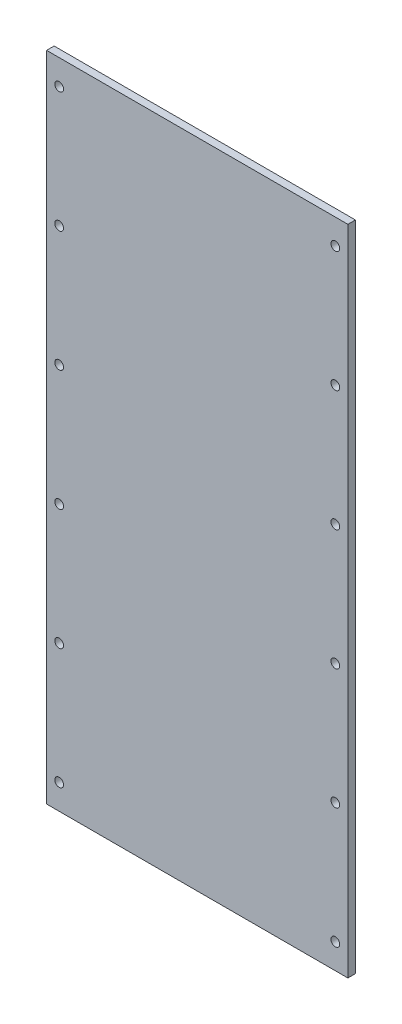
from build123d import *

# Parameters (mm, degrees)
ESQUISSE1_W             = 120
ESQUISSE1_H             = 260
BOSS_EXTRU_1_DEPTH      = 3
ESQUISSE2_R             = 1.747592995
ENL_V_MAT_EXTRU_1_DEPTH = 10


with BuildPart() as part:
    # Esquisse1 → Boss.-Extru.1 (new body)
    with BuildSketch(Plane.XY):
        Rectangle(ESQUISSE1_W, ESQUISSE1_H)
    extrude(amount=BOSS_EXTRU_1_DEPTH)

    # Esquisse2 → Enlèv. mat.-Extru.1 (cut)
    with BuildSketch(Plane.XY.offset(3)):
        with Locations((-55, 120)):
            Circle(ESQUISSE2_R)
        with Locations((55, 120)):
            Circle(ESQUISSE2_R)
        with Locations((-55, 72)):
            Circle(ESQUISSE2_R)
        with Locations((-55, 24)):
            Circle(ESQUISSE2_R)
        with Locations((-55, -24)):
            Circle(ESQUISSE2_R)
        with Locations((-55, -72)):
            Circle(ESQUISSE2_R)
        with Locations((55, 72)):
            Circle(ESQUISSE2_R)
        with Locations((55, 24)):
            Circle(ESQUISSE2_R)
        with Locations((55, -24)):
            Circle(ESQUISSE2_R)
        with Locations((55, -72)):
            Circle(ESQUISSE2_R)
        with Locations((55, -120)):
            Circle(ESQUISSE2_R)
        with Locations((-55, -120)):
            Circle(ESQUISSE2_R)
    extrude(amount=-ENL_V_MAT_EXTRU_1_DEPTH, mode=Mode.SUBTRACT)


solid = part.part
